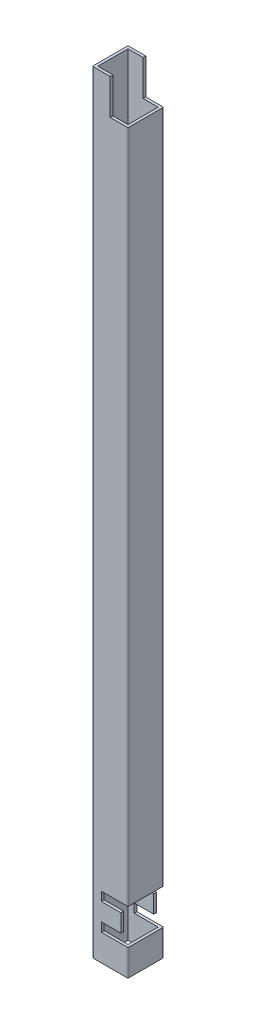
from build123d import *

# Parameters (mm, degrees)
SKETCH1_W                   = 17
SKETCH1_H                   = 17
BOSS_EXTRUDE1_DEPTH         = 1220
SKETCH2_W                   = 20
SKETCH2_H                   = 20
CUT_EXTRUDE1_DEPTH          = 10
CUT_EXTRUDE2_DEPTH          = 15
SKETCH4_W                   = 3
SKETCH4_H                   = 10
CUT_EXTRUDE3_DEPTH          = 10
SKETCH_PATTERN1_START       = -20
SKETCH_PATTERN1_DEPTH       = 15
SKETCH_PATTERN1_2_OUTLINE_W = 1.5
SKETCH_PATTERN1_2_OUTLINE_H = 10
SKETCH_PATTERN1_2_DEPTH     = 3
SKETCH6_W                   = 20
SKETCH6_H                   = 20
CUT_EXTRUDE4_DEPTH          = 4
CUT_EXTRUDE5_DEPTH          = 1221.327824808
CUT_EXTRUDE5_DEPTH_BACK     = 1221.327824808
SKETCH7_W                   = 11
SKETCH7_H                   = 5
SKETCH8_W                   = 20.081282068
SKETCH8_H                   = 792.599518512
CUT_EXTRUDE6_DEPTH          = 20


# Read off the part's stored shape, not the designer's step: Sketch-Pattern1
with BuildPart() as part:
    # Sketch1 → Boss-Extrude1 (new body)
    with BuildSketch(Plane(origin=(0, 0, 0), x_dir=(1, 0, 0), z_dir=(0, 1, 0))):
        with BuildLine():
            Line((0.5, 0), (19.5, 0))
            ThreePointArc((19.5, 0), (19.853553391, 0.146446609), (20, 0.5))
            Line((20, 0.5), (20, 19.5))
            ThreePointArc((20, 19.5), (19.853553391, 19.853553391), (19.5, 20))
            Line((19.5, 20), (0.5, 20))
            ThreePointArc((0.5, 20), (0.146446609, 19.853553391), (0, 19.5))
            Line((0, 19.5), (0, 0.5))
            ThreePointArc((0, 0.5), (0.146446609, 0.146446609), (0.5, 0))
        make_face()
        with Locations((10, 10)):
            Rectangle(SKETCH1_W, SKETCH1_H, mode=Mode.SUBTRACT)
    extrude(amount=BOSS_EXTRUDE1_DEPTH)

    # Sketch2 → Cut-Extrude1 (cut)
    with BuildSketch(Plane(origin=(20, 0, 0), x_dir=(0, 0, -1), z_dir=(1, 0, 0))):
        with Locations((10, 1210)):
            Rectangle(SKETCH2_W, SKETCH2_H)
        with Locations((10, 10)):
            Rectangle(SKETCH2_W, SKETCH2_H)
    extrude(amount=-CUT_EXTRUDE1_DEPTH, mode=Mode.SUBTRACT)

    # Sketch3 → Cut-Extrude2 (cut)
    with BuildSketch(Plane(origin=(0, 0, -20), x_dir=(-1, 0, 0), z_dir=(0, 0, -1))):
        Polygon((-15, 1115), (0, 1115), (0, 1120), (-9, 1120), (-9, 1130), (0, 1130), (0, 1135), (-15, 1135), align=None)
    extrude(amount=-CUT_EXTRUDE2_DEPTH, mode=Mode.SUBTRACT)

    # Sketch4 → Cut-Extrude3 (cut)
    with BuildSketch(Plane.ZY):
        with Locations((-18.5, 1125)):
            Rectangle(SKETCH4_W, SKETCH4_H)
    extrude(amount=-CUT_EXTRUDE3_DEPTH, mode=Mode.SUBTRACT)

    # Sketch-Pattern1 outline → Sketch-Pattern1 (cut)
    with BuildSketch(Plane.XY.offset(SKETCH_PATTERN1_START)):
        Polygon((15, 105), (15, 125), (0, 125), (0, 120), (1.5, 120), (1.5, 110), (0, 110), (0, 105), align=None)
        Polygon((1.5, 350), (1.5, 340), (0, 340), (0, 335), (15, 335), (15, 355), (0, 355), (0, 350), align=None)
        Polygon((1.5, 510), (1.5, 500), (0, 500), (0, 495), (15, 495), (15, 515), (0, 515), (0, 510), align=None)
        Polygon((1.5, 740), (1.5, 730), (0, 730), (0, 725), (15, 725), (15, 745), (0, 745), (0, 740), align=None)
        Polygon((1.5, 900), (1.5, 890), (0, 890), (0, 885), (15, 885), (15, 905), (0, 905), (0, 900), align=None)
    extrude(amount=SKETCH_PATTERN1_DEPTH, mode=Mode.SUBTRACT)

    # Sketch-Pattern1 2 outline → Sketch-Pattern1 2 (cut)
    with BuildSketch(Plane.XY.offset(SKETCH_PATTERN1_START)):
        with Locations((0.75, 115)):
            Rectangle(SKETCH_PATTERN1_2_OUTLINE_W, SKETCH_PATTERN1_2_OUTLINE_H)
        with Locations((0.75, 345)):
            Rectangle(SKETCH_PATTERN1_2_OUTLINE_W, SKETCH_PATTERN1_2_OUTLINE_H)
        with Locations((0.75, 505)):
            Rectangle(SKETCH_PATTERN1_2_OUTLINE_W, SKETCH_PATTERN1_2_OUTLINE_H)
        with Locations((0.75, 735)):
            Rectangle(SKETCH_PATTERN1_2_OUTLINE_W, SKETCH_PATTERN1_2_OUTLINE_H)
        with Locations((0.75, 895)):
            Rectangle(SKETCH_PATTERN1_2_OUTLINE_W, SKETCH_PATTERN1_2_OUTLINE_H)
    extrude(amount=SKETCH_PATTERN1_2_DEPTH, mode=Mode.SUBTRACT)

    # Sketch6 → Cut-Extrude4 (cut)
    with BuildSketch(Plane(origin=(20, 0, 0), x_dir=(0, 0, -1), z_dir=(1, 0, 0))):
        with Locations((10, 810)):
            Rectangle(SKETCH6_W, SKETCH6_H)
    extrude(amount=-CUT_EXTRUDE4_DEPTH, mode=Mode.SUBTRACT)

    # Sketch7 → Cut-Extrude5 (cut, two sides: drawn at the far end of the back side and taken through both)
    with BuildSketch(Plane(origin=(0, 0, -20), x_dir=(-1, 0, 0), z_dir=(0, 0, -1)).offset(-CUT_EXTRUDE5_DEPTH_BACK)):
        with Locations((-10.5, 817.5)):
            Rectangle(SKETCH7_W, SKETCH7_H)
        with Locations((-10.5, 802.5)):
            Rectangle(SKETCH7_W, SKETCH7_H)
    extrude(amount=CUT_EXTRUDE5_DEPTH + CUT_EXTRUDE5_DEPTH_BACK, mode=Mode.SUBTRACT)

    # Sketch8 → Cut-Extrude6 (cut)
    with BuildSketch(Plane(origin=(0, 0, -20), x_dir=(-1, 0, 0), z_dir=(0, 0, -1))):
        with Locations((-10.040641034, 388.700240744)):
            Rectangle(SKETCH8_W, SKETCH8_H)
    extrude(amount=-CUT_EXTRUDE6_DEPTH, mode=Mode.SUBTRACT)


solid = part.part
